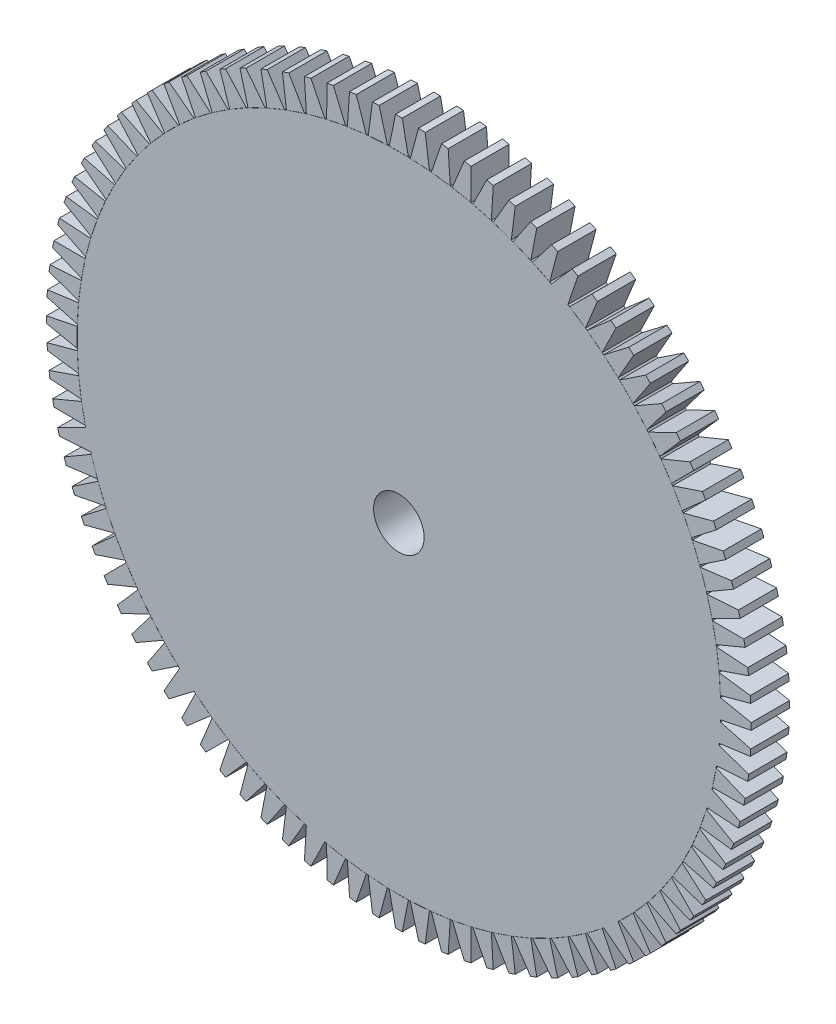
from build123d import *

# Parameters (mm, degrees)
BOSS_EXTRUDE1_DEPTH = 1.524
SKETCH2_R           = 1.00584
CUT_EXTRUDE1_DEPTH  = 1.524


with BuildPart() as part:
    # Sketch1 → Boss-Extrude1 (new body)
    with BuildSketch(Plane.XY):
        with BuildLine():
            Line((-0.133348492, 14.021434137), (-0.381, 12.795929101))
            ThreePointArc((-0.381, 12.795929101), (0, 12.8016), (0.381, 12.795929101))
            Line((0.381, 12.795929101), (0.133348492, 14.020165863))
            Line((0.133348492, 14.020165863), (-0.133348492, 14.021434137))
        make_face()
        with BuildLine():
            Line((0.381, 12.795929101), (-0.381, 12.795929101))
            ThreePointArc((-0.381, 12.795929101), (-0.418856611, 12.794745863), (-0.456709555, 12.793450627))
            Line((-0.456709555, 12.793450627), (-1.217078054, 12.743613442))
            ThreePointArc((-1.217078054, 12.743613442), (-1.254776224, 12.739956797), (-1.292463409, 12.736188633))
            Line((-1.292463409, 12.736188633), (-2.047944394, 12.636727675))
            ThreePointArc((-2.047944394, 12.636727675), (-2.085322692, 12.63061328), (-2.122682737, 12.624388324))
            Line((-2.122682737, 12.624388324), (-2.870041121, 12.475729499))
            ThreePointArc((-2.870041121, 12.475729499), (-2.906939489, 12.467183538), (-2.943812411, 12.458528446))
            Line((-2.943812411, 12.458528446), (-3.679847891, 12.261308334))
            ThreePointArc((-3.679847891, 12.261308334), (-3.716108324, 12.250367402), (-3.752336229, 12.239319237))
            Line((-3.752336229, 12.239319237), (-4.473896988, 11.994382364))
            ThreePointArc((-4.473896988, 11.994382364), (-4.509364213, 11.981093312), (-4.544791967, 11.967699384))
            Line((-4.544791967, 11.967699384), (-5.248788171, 11.676094608))
            ThreePointArc((-5.248788171, 11.676094608), (-5.283310313, 11.660514341), (-5.317786208, 11.644832004))
            Line((-5.317786208, 11.644832004), (-6.001203237, 11.307808022))
            ThreePointArc((-6.001203237, 11.307808022), (-6.034632466, 11.290003258), (-6.068008872, 11.272099667))
            Line((-6.068008872, 11.272099667), (-6.727920229, 10.891099667))
            ThreePointArc((-6.727920229, 10.891099667), (-6.760113397, 10.871146647), (-6.79224739, 10.851098468))
            Line((-6.79224739, 10.851098468), (-7.425827235, 10.42775395))
            ThreePointArc((-7.425827235, 10.42775395), (-7.456646484, 10.405738117), (-7.487400462, 10.383631199))
            Line((-7.487400462, 10.383631199), (-8.091935708, 9.91975499))
            ThreePointArc((-8.091935708, 9.91975499), (-8.121249067, 9.89577062), (-8.150491336, 9.871699627))
            Line((-8.150491336, 9.871699627), (-8.72339327, 9.369278116))
            ThreePointArc((-8.72339327, 9.369278116), (-8.751075214, 9.343427913), (-8.778680555, 9.317495923))
            Line((-8.778680555, 9.317495923), (-9.317495923, 8.778680555))
            ThreePointArc((-9.317495923, 8.778680555), (-9.343427913, 8.751075214), (-9.369278116, 8.72339327))
            Line((-9.369278116, 8.72339327), (-9.871699627, 8.150491336))
            ThreePointArc((-9.871699627, 8.150491336), (-9.89577062, 8.121249067), (-9.91975499, 8.091935708))
            Line((-9.91975499, 8.091935708), (-10.383631199, 7.487400462))
            ThreePointArc((-10.383631199, 7.487400462), (-10.405738117, 7.456646484), (-10.42775395, 7.425827235))
            Line((-10.42775395, 7.425827235), (-10.851098468, 6.79224739))
            ThreePointArc((-10.851098468, 6.79224739), (-10.871146647, 6.760113397), (-10.891099667, 6.727920229))
            Line((-10.891099667, 6.727920229), (-11.272099667, 6.068008872))
            ThreePointArc((-11.272099667, 6.068008872), (-11.290003258, 6.034632466), (-11.307808022, 6.001203237))
            Line((-11.307808022, 6.001203237), (-11.644832004, 5.317786208))
            ThreePointArc((-11.644832004, 5.317786208), (-11.660514341, 5.283310313), (-11.676094608, 5.248788171))
            Line((-11.676094608, 5.248788171), (-11.967699384, 4.544791967))
            ThreePointArc((-11.967699384, 4.544791967), (-11.981093312, 4.509364213), (-11.994382364, 4.473896988))
            Line((-11.994382364, 4.473896988), (-12.239319237, 3.752336229))
            ThreePointArc((-12.239319237, 3.752336229), (-12.250367402, 3.716108324), (-12.261308334, 3.679847891))
            Line((-12.261308334, 3.679847891), (-12.458528446, 2.943812411))
            ThreePointArc((-12.458528446, 2.943812411), (-12.467183538, 2.906939489), (-12.475729499, 2.870041121))
            Line((-12.475729499, 2.870041121), (-12.624388324, 2.122682737))
            ThreePointArc((-12.624388324, 2.122682737), (-12.63061328, 2.085322692), (-12.636727675, 2.047944394))
            Line((-12.636727675, 2.047944394), (-12.736188633, 1.292463409))
            ThreePointArc((-12.736188633, 1.292463409), (-12.739956797, 1.254776224), (-12.743613442, 1.217078054))
            Line((-12.743613442, 1.217078054), (-12.793450627, 0.456709555))
            ThreePointArc((-12.793450627, 0.456709555), (-12.794745863, 0.418856611), (-12.795929101, 0.381))
            Line((-12.795929101, 0.381), (-12.795929101, -0.381))
            ThreePointArc((-12.795929101, -0.381), (-12.794745863, -0.418856611), (-12.793450627, -0.456709555))
            Line((-12.793450627, -0.456709555), (-12.743613442, -1.217078054))
            ThreePointArc((-12.743613442, -1.217078054), (-12.739956797, -1.254776224), (-12.736188633, -1.292463409))
            Line((-12.736188633, -1.292463409), (-12.636727675, -2.047944394))
            ThreePointArc((-12.636727675, -2.047944394), (-12.63061328, -2.085322692), (-12.624388324, -2.122682737))
            Line((-12.624388324, -2.122682737), (-12.475729499, -2.870041121))
            ThreePointArc((-12.475729499, -2.870041121), (-12.467183538, -2.906939489), (-12.458528446, -2.943812411))
            Line((-12.458528446, -2.943812411), (-13.576953425, -3.499881188))
            Line((-13.576953425, -3.499881188), (-13.509152225, -3.757818947))
            Line((-13.509152225, -3.757818947), (-12.261308334, -3.679847891))
            ThreePointArc((-12.261308334, -3.679847891), (-12.250367402, -3.716108324), (-12.239319237, -3.752336229))
            Line((-12.239319237, -3.752336229), (-11.994382364, -4.473896988))
            ThreePointArc((-11.994382364, -4.473896988), (-11.981093312, -4.509364213), (-11.967699384, -4.544791967))
            Line((-11.967699384, -4.544791967), (-11.676094608, -5.248788171))
            ThreePointArc((-11.676094608, -5.248788171), (-11.660514341, -5.283310313), (-11.644832004, -5.317786208))
            Line((-11.644832004, -5.317786208), (-11.307808022, -6.001203237))
            ThreePointArc((-11.307808022, -6.001203237), (-11.290003258, -6.034632466), (-11.272099667, -6.068008872))
            Line((-11.272099667, -6.068008872), (-10.891099667, -6.727920229))
            ThreePointArc((-10.891099667, -6.727920229), (-10.871146647, -6.760113397), (-10.851098468, -6.79224739))
            Line((-10.851098468, -6.79224739), (-10.42775395, -7.425827235))
            ThreePointArc((-10.42775395, -7.425827235), (-10.405738117, -7.456646484), (-10.383631199, -7.487400462))
            Line((-10.383631199, -7.487400462), (-9.91975499, -8.091935708))
            ThreePointArc((-9.91975499, -8.091935708), (-9.89577062, -8.121249067), (-9.871699627, -8.150491336))
            Line((-9.871699627, -8.150491336), (-9.369278116, -8.72339327))
            ThreePointArc((-9.369278116, -8.72339327), (-9.343427913, -8.751075214), (-9.317495923, -8.778680555))
            Line((-9.317495923, -8.778680555), (-8.778680555, -9.317495923))
            ThreePointArc((-8.778680555, -9.317495923), (-8.751075214, -9.343427913), (-8.72339327, -9.369278116))
            Line((-8.72339327, -9.369278116), (-9.344394393, -10.452996033))
            Line((-9.344394393, -10.452996033), (-9.144717215, -10.629795113))
            Line((-9.144717215, -10.629795113), (-8.150491336, -9.871699627))
            ThreePointArc((-8.150491336, -9.871699627), (-8.121249067, -9.89577062), (-8.091935708, -9.91975499))
            Line((-8.091935708, -9.91975499), (-7.487400462, -10.383631199))
            ThreePointArc((-7.487400462, -10.383631199), (-7.456646484, -10.405738117), (-7.425827235, -10.42775395))
            Line((-7.425827235, -10.42775395), (-6.79224739, -10.851098468))
            ThreePointArc((-6.79224739, -10.851098468), (-6.760113397, -10.871146647), (-6.727920229, -10.891099667))
            Line((-6.727920229, -10.891099667), (-6.068008872, -11.272099667))
            ThreePointArc((-6.068008872, -11.272099667), (-6.034632466, -11.290003258), (-6.001203237, -11.307808022))
            Line((-6.001203237, -11.307808022), (-5.317786208, -11.644832004))
            ThreePointArc((-5.317786208, -11.644832004), (-5.283310313, -11.660514341), (-5.248788171, -11.676094608))
            Line((-5.248788171, -11.676094608), (-4.544791967, -11.967699384))
            ThreePointArc((-4.544791967, -11.967699384), (-4.509364213, -11.981093312), (-4.473896988, -11.994382364))
            Line((-4.473896988, -11.994382364), (-3.752336229, -12.239319237))
            ThreePointArc((-3.752336229, -12.239319237), (-3.716108324, -12.250367402), (-3.679847891, -12.261308334))
            Line((-3.679847891, -12.261308334), (-3.757490693, -13.507927166))
            Line((-3.757490693, -13.507927166), (-3.500209442, -13.578178484))
            Line((-3.500209442, -13.578178484), (-2.943812411, -12.458528446))
            ThreePointArc((-2.943812411, -12.458528446), (-2.906939489, -12.467183538), (-2.870041121, -12.475729499))
            Line((-2.870041121, -12.475729499), (-2.122682737, -12.624388324))
            ThreePointArc((-2.122682737, -12.624388324), (-2.085322692, -12.63061328), (-2.047944394, -12.636727675))
            Line((-2.047944394, -12.636727675), (-1.292463409, -12.736188633))
            ThreePointArc((-1.292463409, -12.736188633), (-1.254776224, -12.739956797), (-1.217078054, -12.743613442))
            Line((-1.217078054, -12.743613442), (-0.456709555, -12.793450627))
            ThreePointArc((-0.456709555, -12.793450627), (-0.418856611, -12.794745863), (-0.381, -12.795929101))
            Line((-0.381, -12.795929101), (0.381, -12.795929101))
            ThreePointArc((0.381, -12.795929101), (0.418856611, -12.794745863), (0.456709555, -12.793450627))
            Line((0.456709555, -12.793450627), (1.217078054, -12.743613442))
            ThreePointArc((1.217078054, -12.743613442), (1.254776224, -12.739956797), (1.292463409, -12.736188633))
            Line((1.292463409, -12.736188633), (2.047944394, -12.636727675))
            ThreePointArc((2.047944394, -12.636727675), (2.085322692, -12.63061328), (2.122682737, -12.624388324))
            Line((2.122682737, -12.624388324), (2.870041121, -12.475729499))
            ThreePointArc((2.870041121, -12.475729499), (2.906939489, -12.467183538), (2.943812411, -12.458528446))
            Line((2.943812411, -12.458528446), (3.679847891, -12.261308334))
            ThreePointArc((3.679847891, -12.261308334), (3.716108324, -12.250367402), (3.752336229, -12.239319237))
            Line((3.752336229, -12.239319237), (4.473896988, -11.994382364))
            ThreePointArc((4.473896988, -11.994382364), (4.509364213, -11.981093312), (4.544791967, -11.967699384))
            Line((4.544791967, -11.967699384), (5.248788171, -11.676094608))
            ThreePointArc((5.248788171, -11.676094608), (5.283310313, -11.660514341), (5.317786208, -11.644832004))
            Line((5.317786208, -11.644832004), (6.001203237, -11.307808022))
            ThreePointArc((6.001203237, -11.307808022), (6.034632466, -11.290003258), (6.068008872, -11.272099667))
            Line((6.068008872, -11.272099667), (6.727920229, -10.891099667))
            ThreePointArc((6.727920229, -10.891099667), (6.760113397, -10.871146647), (6.79224739, -10.851098468))
            Line((6.79224739, -10.851098468), (7.425827235, -10.42775395))
            ThreePointArc((7.425827235, -10.42775395), (7.456646484, -10.405738117), (7.487400462, -10.383631199))
            Line((7.487400462, -10.383631199), (8.091935708, -9.91975499))
            ThreePointArc((8.091935708, -9.91975499), (8.121249067, -9.89577062), (8.150491336, -9.871699627))
            Line((8.150491336, -9.871699627), (9.143880984, -10.628841573))
            Line((9.143880984, -10.628841573), (9.345230625, -10.453949572))
            Line((9.345230625, -10.453949572), (8.72339327, -9.369278116))
            ThreePointArc((8.72339327, -9.369278116), (8.751075214, -9.343427913), (8.778680555, -9.317495923))
            Line((8.778680555, -9.317495923), (9.317495923, -8.778680555))
            ThreePointArc((9.317495923, -8.778680555), (9.343427913, -8.751075214), (9.369278116, -8.72339327))
            Line((9.369278116, -8.72339327), (9.871699627, -8.150491336))
            ThreePointArc((9.871699627, -8.150491336), (9.89577062, -8.121249067), (9.91975499, -8.091935708))
            Line((9.91975499, -8.091935708), (10.383631199, -7.487400462))
            ThreePointArc((10.383631199, -7.487400462), (10.405738117, -7.456646484), (10.42775395, -7.425827235))
            Line((10.42775395, -7.425827235), (10.851098468, -6.79224739))
            ThreePointArc((10.851098468, -6.79224739), (10.871146647, -6.760113397), (10.891099667, -6.727920229))
            Line((10.891099667, -6.727920229), (11.272099667, -6.068008872))
            ThreePointArc((11.272099667, -6.068008872), (11.290003258, -6.034632466), (11.307808022, -6.001203237))
            Line((11.307808022, -6.001203237), (11.644832004, -5.317786208))
            ThreePointArc((11.644832004, -5.317786208), (11.660514341, -5.283310313), (11.676094608, -5.248788171))
            Line((11.676094608, -5.248788171), (11.967699384, -4.544791967))
            ThreePointArc((11.967699384, -4.544791967), (11.981093312, -4.509364213), (11.994382364, -4.473896988))
            Line((11.994382364, -4.473896988), (12.239319237, -3.752336229))
            ThreePointArc((12.239319237, -3.752336229), (12.250367402, -3.716108324), (12.261308334, -3.679847891))
            Line((12.261308334, -3.679847891), (13.507927166, -3.757490693))
            Line((13.507927166, -3.757490693), (13.578178484, -3.500209442))
            Line((13.578178484, -3.500209442), (12.458528446, -2.943812411))
            ThreePointArc((12.458528446, -2.943812411), (12.467183538, -2.906939489), (12.475729499, -2.870041121))
            Line((12.475729499, -2.870041121), (12.624388324, -2.122682737))
            ThreePointArc((12.624388324, -2.122682737), (12.63061328, -2.085322692), (12.636727675, -2.047944394))
            Line((12.636727675, -2.047944394), (13.882815929, -1.962206542))
            Line((13.882815929, -1.962206542), (13.918884295, -1.69795673))
            Line((13.918884295, -1.69795673), (12.736188633, -1.292463409))
            ThreePointArc((12.736188633, -1.292463409), (12.739956797, -1.254776224), (12.743613442, -1.217078054))
            Line((12.743613442, -1.217078054), (13.981426203, -1.050025703))
            Line((13.981426203, -1.050025703), (14.000134579, -0.783982686))
            Line((14.000134579, -0.783982686), (12.793450627, -0.456709555))
            ThreePointArc((12.793450627, -0.456709555), (12.794745863, -0.418856611), (12.795929101, -0.381))
            Line((12.795929101, -0.381), (14.020165863, -0.133348492))
            Line((14.020165863, -0.133348492), (14.021434137, 0.133348492))
            Line((14.021434137, 0.133348492), (12.795929101, 0.381))
            ThreePointArc((12.795929101, 0.381), (12.794745863, 0.418856611), (12.793450627, 0.456709555))
            Line((12.793450627, 0.456709555), (12.743613442, 1.217078054))
            ThreePointArc((12.743613442, 1.217078054), (12.739956797, 1.254776224), (12.736188633, 1.292463409))
            Line((12.736188633, 1.292463409), (12.636727675, 2.047944394))
            ThreePointArc((12.636727675, 2.047944394), (12.63061328, 2.085322692), (12.624388324, 2.122682737))
            Line((12.624388324, 2.122682737), (12.475729499, 2.870041121))
            ThreePointArc((12.475729499, 2.870041121), (12.467183538, 2.906939489), (12.458528446, 2.943812411))
            Line((12.458528446, 2.943812411), (12.261308334, 3.679847891))
            ThreePointArc((12.261308334, 3.679847891), (12.250367402, 3.716108324), (12.239319237, 3.752336229))
            Line((12.239319237, 3.752336229), (11.994382364, 4.473896988))
            ThreePointArc((11.994382364, 4.473896988), (11.981093312, 4.509364213), (11.967699384, 4.544791967))
            Line((11.967699384, 4.544791967), (11.676094608, 5.248788171))
            ThreePointArc((11.676094608, 5.248788171), (11.660514341, 5.283310313), (11.644832004, 5.317786208))
            Line((11.644832004, 5.317786208), (11.307808022, 6.001203237))
            ThreePointArc((11.307808022, 6.001203237), (11.290003258, 6.034632466), (11.272099667, 6.068008872))
            Line((11.272099667, 6.068008872), (10.891099667, 6.727920229))
            ThreePointArc((10.891099667, 6.727920229), (10.871146647, 6.760113397), (10.851098468, 6.79224739))
            Line((10.851098468, 6.79224739), (10.42775395, 7.425827235))
            ThreePointArc((10.42775395, 7.425827235), (10.405738117, 7.456646484), (10.383631199, 7.487400462))
            Line((10.383631199, 7.487400462), (9.91975499, 8.091935708))
            ThreePointArc((9.91975499, 8.091935708), (9.89577062, 8.121249067), (9.871699627, 8.150491336))
            Line((9.871699627, 8.150491336), (9.369278116, 8.72339327))
            ThreePointArc((9.369278116, 8.72339327), (9.343427913, 8.751075214), (9.317495923, 8.778680555))
            Line((9.317495923, 8.778680555), (8.778680555, 9.317495923))
            ThreePointArc((8.778680555, 9.317495923), (8.751075214, 9.343427913), (8.72339327, 9.369278116))
            Line((8.72339327, 9.369278116), (8.150491336, 9.871699627))
            ThreePointArc((8.150491336, 9.871699627), (8.121249067, 9.89577062), (8.091935708, 9.91975499))
            Line((8.091935708, 9.91975499), (7.487400462, 10.383631199))
            ThreePointArc((7.487400462, 10.383631199), (7.456646484, 10.405738117), (7.425827235, 10.42775395))
            Line((7.425827235, 10.42775395), (6.79224739, 10.851098468))
            ThreePointArc((6.79224739, 10.851098468), (6.760113397, 10.871146647), (6.727920229, 10.891099667))
            Line((6.727920229, 10.891099667), (7.125566113, 12.075145556))
            Line((7.125566113, 12.075145556), (6.895233887, 12.209592406))
            Line((6.895233887, 12.209592406), (6.068008872, 11.272099667))
            ThreePointArc((6.068008872, 11.272099667), (6.034632466, 11.290003258), (6.001203237, 11.307808022))
            Line((6.001203237, 11.307808022), (5.317786208, 11.644832004))
            ThreePointArc((5.317786208, 11.644832004), (5.283310313, 11.660514341), (5.248788171, 11.676094608))
            Line((5.248788171, 11.676094608), (4.544791967, 11.967699384))
            ThreePointArc((4.544791967, 11.967699384), (4.509364213, 11.981093312), (4.473896988, 11.994382364))
            Line((4.473896988, 11.994382364), (3.752336229, 12.239319237))
            ThreePointArc((3.752336229, 12.239319237), (3.716108324, 12.250367402), (3.679847891, 12.261308334))
            Line((3.679847891, 12.261308334), (2.943812411, 12.458528446))
            ThreePointArc((2.943812411, 12.458528446), (2.906939489, 12.467183538), (2.870041121, 12.475729499))
            Line((2.870041121, 12.475729499), (2.122682737, 12.624388324))
            ThreePointArc((2.122682737, 12.624388324), (2.085322692, 12.63061328), (2.047944394, 12.636727675))
            Line((2.047944394, 12.636727675), (1.292463409, 12.736188633))
            ThreePointArc((1.292463409, 12.736188633), (1.254776224, 12.739956797), (1.217078054, 12.743613442))
            Line((1.217078054, 12.743613442), (0.456709555, 12.793450627))
            ThreePointArc((0.456709555, 12.793450627), (0.418856611, 12.794745863), (0.381, 12.795929101))
        make_face()
        with BuildLine():
            ThreePointArc((-1.217078054, 12.743613442), (-0.837264699, 12.774190792), (-0.456709555, 12.793450627))
            Line((-0.456709555, 12.793450627), (-0.783899737, 13.99886902))
            Line((-0.783899737, 13.99886902), (-1.050108652, 13.982691762))
            Line((-1.050108652, 13.982691762), (-1.217078054, 12.743613442))
        make_face()
        with BuildLine():
            Line((0.783982686, 14.000134579), (0.456709555, 12.793450627))
            ThreePointArc((0.456709555, 12.793450627), (0.837264699, 12.774190792), (1.217078054, 12.743613442))
            Line((1.217078054, 12.743613442), (1.050025703, 13.981426203))
            Line((1.050025703, 13.981426203), (0.783982686, 14.000134579))
        make_face()
        with BuildLine():
            ThreePointArc((-2.047944394, 12.636727675), (-1.670944102, 12.692080537), (-1.292463409, 12.736188633))
            Line((-1.292463409, 12.736188633), (-1.697791187, 13.917626871))
            Line((-1.697791187, 13.917626871), (-1.962372085, 13.884073354))
            Line((-1.962372085, 13.884073354), (-2.047944394, 12.636727675))
        make_face()
        with BuildLine():
            Line((1.69795673, 13.918884295), (1.292463409, 12.736188633))
            ThreePointArc((1.292463409, 12.736188633), (1.670944102, 12.692080537), (2.047944394, 12.636727675))
            Line((2.047944394, 12.636727675), (1.962206542, 13.882815929))
            Line((1.962206542, 13.882815929), (1.69795673, 13.918884295))
        make_face()
        with BuildLine():
            ThreePointArc((-2.870041121, 12.475729499), (-2.497468266, 12.555620846), (-2.122682737, 12.624388324))
            Line((-2.122682737, 12.624388324), (-2.604412435, 13.776787307))
            Line((-2.604412435, 13.776787307), (-2.866232339, 13.726001212))
            Line((-2.866232339, 13.726001212), (-2.870041121, 12.475729499))
        make_face()
        with BuildLine():
            Line((2.604659863, 13.778031212), (2.122682737, 12.624388324))
            ThreePointArc((2.122682737, 12.624388324), (2.497468266, 12.555620846), (2.870041121, 12.475729499))
            Line((2.870041121, 12.475729499), (2.865984911, 13.724757307))
            Line((2.865984911, 13.724757307), (2.604659863, 13.778031212))
        make_face()
        with BuildLine():
            ThreePointArc((-3.679847891, 12.261308334), (-3.313297888, 12.365396058), (-2.943812411, 12.458528446))
            Line((-2.943812411, 12.458528446), (-3.499881188, 13.576953425))
            Line((-3.499881188, 13.576953425), (-3.757818947, 13.509152225))
            Line((-3.757818947, 13.509152225), (-3.679847891, 12.261308334))
        make_face()
        with BuildLine():
            Line((3.500209442, 13.578178484), (2.943812411, 12.458528446))
            ThreePointArc((2.943812411, 12.458528446), (3.313297888, 12.365396058), (3.679847891, 12.261308334))
            Line((3.679847891, 12.261308334), (3.757490693, 13.507927166))
            Line((3.757490693, 13.507927166), (3.500209442, 13.578178484))
        make_face()
        with BuildLine():
            ThreePointArc((-4.473896988, 11.994382364), (-4.114939459, 12.122220746), (-3.752336229, 12.239319237))
            Line((-3.752336229, 12.239319237), (-4.380362913, 13.318980944))
            Line((-4.380362913, 13.318980944), (-4.633313997, 13.234454975))
            Line((-4.633313997, 13.234454975), (-4.473896988, 11.994382364))
        make_face()
        with BuildLine():
            Line((4.380770587, 13.320181911), (3.752336229, 12.239319237))
            ThreePointArc((3.752336229, 12.239319237), (4.114939459, 12.122220746), (4.473896988, 11.994382364))
            Line((4.473896988, 11.994382364), (4.632906323, 13.233254008))
            Line((4.632906323, 13.233254008), (4.380770587, 13.320181911))
        make_face()
        with BuildLine():
            ThreePointArc((-5.248788171, 11.676094608), (-4.898960228, 11.827136223), (-4.544791967, 11.967699384))
            Line((-4.544791967, 11.967699384), (-5.242087252, 13.003974542))
            Line((-5.242087252, 13.003974542), (-5.488968485, 12.903085757))
            Line((-5.488968485, 12.903085757), (-5.248788171, 11.676094608))
        make_face()
        with BuildLine():
            Line((5.2425726, 13.005146275), (4.544791967, 11.967699384))
            ThreePointArc((4.544791967, 11.967699384), (4.898960228, 11.827136223), (5.248788171, 11.676094608))
            Line((5.248788171, 11.676094608), (5.488483137, 12.901914024))
            Line((5.488483137, 12.901914024), (5.2425726, 13.005146275))
        make_face()
        with BuildLine():
            ThreePointArc((-6.001203237, 11.307808022), (-5.662002897, 11.481406088), (-5.317786208, 11.644832004))
            Line((-5.317786208, 11.644832004), (-6.081364168, 12.633283124))
            Line((-6.081364168, 12.633283124), (-6.321118367, 12.516463545))
            Line((-6.321118367, 12.516463545), (-6.001203237, 11.307808022))
        make_face()
        with BuildLine():
            Line((6.081925112, 12.634420605), (5.317786208, 11.644832004))
            ThreePointArc((5.317786208, 11.644832004), (5.662002897, 11.481406088), (6.001203237, 11.307808022))
            Line((6.001203237, 11.307808022), (6.320557424, 12.515326064))
            Line((6.320557424, 12.515326064), (6.081925112, 12.634420605))
        make_face()
        with BuildLine():
            ThreePointArc((-6.727920229, 10.891099667), (-6.4008, 11.086510809), (-6.068008872, 11.272099667))
            Line((-6.068008872, 11.272099667), (-6.89459975, 12.208494049))
            Line((-6.89459975, 12.208494049), (-7.12620025, 12.076243914))
            Line((-7.12620025, 12.076243914), (-6.727920229, 10.891099667))
        make_face()
        with BuildLine():
            ThreePointArc((-7.425827235, 10.42775395), (-7.112187895, 10.644141389), (-6.79224739, 10.851098468))
            Line((-6.79224739, 10.851098468), (-7.678311596, 11.731426327))
            Line((-7.678311596, 11.731426327), (-7.90076665, 11.584311953))
            Line((-7.90076665, 11.584311953), (-7.425827235, 10.42775395))
        make_face()
        with BuildLine():
            Line((7.679016212, 11.732480859), (6.79224739, 10.851098468))
            ThreePointArc((6.79224739, 10.851098468), (7.112187895, 10.644141389), (7.425827235, 10.42775395))
            Line((7.425827235, 10.42775395), (7.900062034, 11.583257421))
            Line((7.900062034, 11.583257421), (7.679016212, 11.732480859))
        make_face()
        with BuildLine():
            ThreePointArc((-8.091935708, 9.91975499), (-7.79312031, 10.156192121), (-7.487400462, 10.383631199))
            Line((-7.487400462, 10.383631199), (-8.429143734, 11.204122837))
            Line((-8.429143734, 11.204122837), (-8.641500754, 11.04277419))
            Line((-8.641500754, 11.04277419), (-8.091935708, 9.91975499))
        make_face()
        with BuildLine():
            Line((8.42991581, 11.205129027), (7.487400462, 10.383631199))
            ThreePointArc((7.487400462, 10.383631199), (7.79312031, 10.156192121), (8.091935708, 9.91975499))
            Line((8.091935708, 9.91975499), (8.640728677, 11.041768))
            Line((8.640728677, 11.041768), (8.42991581, 11.205129027))
        make_face()
        with BuildLine():
            ThreePointArc((-8.72339327, 9.369278116), (-8.440681387, 9.624752479), (-8.150491336, 9.871699627))
            Line((-8.150491336, 9.871699627), (-9.143880984, 10.628841573))
            Line((-9.143880984, 10.628841573), (-9.345230625, 10.453949572))
            Line((-9.345230625, 10.453949572), (-8.72339327, 9.369278116))
        make_face()
        with BuildLine():
            Line((9.144717215, 10.629795113), (8.150491336, 9.871699627))
            ThreePointArc((8.150491336, 9.871699627), (8.440681387, 9.624752479), (8.72339327, 9.369278116))
            Line((8.72339327, 9.369278116), (9.344394393, 10.452996033))
            Line((9.344394393, 10.452996033), (9.144717215, 10.629795113))
        make_face()
        with BuildLine():
            ThreePointArc((-9.317495923, 8.778680555), (-9.05209817, 9.05209817), (-8.778680555, 9.317495923))
            Line((-8.778680555, 9.317495923), (-9.819462732, 10.008045978))
            Line((-9.819462732, 10.008045978), (-10.008942783, 9.820359537))
            Line((-10.008942783, 9.820359537), (-9.317495923, 8.778680555))
        make_face()
        with BuildLine():
            Line((9.820359537, 10.008942783), (8.778680555, 9.317495923))
            ThreePointArc((8.778680555, 9.317495923), (9.05209817, 9.05209817), (9.317495923, 8.778680555))
            Line((9.317495923, 8.778680555), (10.008045978, 9.819462732))
            Line((10.008045978, 9.819462732), (9.820359537, 10.008942783))
        make_face()
        with BuildLine():
            ThreePointArc((-9.871699627, 8.150491336), (-9.624752479, 8.440681387), (-9.369278116, 8.72339327))
            Line((-9.369278116, 8.72339327), (-10.452996033, 9.344394393))
            Line((-10.452996033, 9.344394393), (-10.629795113, 9.144717215))
            Line((-10.629795113, 9.144717215), (-9.871699627, 8.150491336))
        make_face()
        with BuildLine():
            Line((10.453949572, 9.345230625), (9.369278116, 8.72339327))
            ThreePointArc((9.369278116, 8.72339327), (9.624752479, 8.440681387), (9.871699627, 8.150491336))
            Line((9.871699627, 8.150491336), (10.628841573, 9.143880984))
            Line((10.628841573, 9.143880984), (10.453949572, 9.345230625))
        make_face()
        with BuildLine():
            ThreePointArc((-10.383631199, 7.487400462), (-10.156192121, 7.79312031), (-9.91975499, 8.091935708))
            Line((-9.91975499, 8.091935708), (-11.041768, 8.640728677))
            Line((-11.041768, 8.640728677), (-11.205129027, 8.42991581))
            Line((-11.205129027, 8.42991581), (-10.383631199, 7.487400462))
        make_face()
        with BuildLine():
            Line((11.04277419, 8.641500754), (9.91975499, 8.091935708))
            ThreePointArc((9.91975499, 8.091935708), (10.156192121, 7.79312031), (10.383631199, 7.487400462))
            Line((10.383631199, 7.487400462), (11.204122837, 8.429143734))
            Line((11.204122837, 8.429143734), (11.04277419, 8.641500754))
        make_face()
        with BuildLine():
            ThreePointArc((-10.851098468, 6.79224739), (-10.644141389, 7.112187895), (-10.42775395, 7.425827235))
            Line((-10.42775395, 7.425827235), (-11.583257421, 7.900062034))
            Line((-11.583257421, 7.900062034), (-11.732480859, 7.679016212))
            Line((-11.732480859, 7.679016212), (-10.851098468, 6.79224739))
        make_face()
        with BuildLine():
            Line((11.584311953, 7.90076665), (10.42775395, 7.425827235))
            ThreePointArc((10.42775395, 7.425827235), (10.644141389, 7.112187895), (10.851098468, 6.79224739))
            Line((10.851098468, 6.79224739), (11.731426327, 7.678311596))
            Line((11.731426327, 7.678311596), (11.584311953, 7.90076665))
        make_face()
        with BuildLine():
            ThreePointArc((-11.272099667, 6.068008872), (-11.086510809, 6.4008), (-10.891099667, 6.727920229))
            Line((-10.891099667, 6.727920229), (-12.075145556, 7.125566113))
            Line((-12.075145556, 7.125566113), (-12.209592406, 6.895233887))
            Line((-12.209592406, 6.895233887), (-11.272099667, 6.068008872))
        make_face()
        with BuildLine():
            Line((12.076243914, 7.12620025), (10.891099667, 6.727920229))
            ThreePointArc((10.891099667, 6.727920229), (11.086510809, 6.4008), (11.272099667, 6.068008872))
            Line((11.272099667, 6.068008872), (12.208494049, 6.89459975))
            Line((12.208494049, 6.89459975), (12.076243914, 7.12620025))
        make_face()
        with BuildLine():
            ThreePointArc((-11.644832004, 5.317786208), (-11.481406088, 5.662002897), (-11.307808022, 6.001203237))
            Line((-11.307808022, 6.001203237), (-12.515326064, 6.320557424))
            Line((-12.515326064, 6.320557424), (-12.634420605, 6.081925112))
            Line((-12.634420605, 6.081925112), (-11.644832004, 5.317786208))
        make_face()
        with BuildLine():
            Line((12.516463545, 6.321118367), (11.307808022, 6.001203237))
            ThreePointArc((11.307808022, 6.001203237), (11.481406088, 5.662002897), (11.644832004, 5.317786208))
            Line((11.644832004, 5.317786208), (12.633283124, 6.081364168))
            Line((12.633283124, 6.081364168), (12.516463545, 6.321118367))
        make_face()
        with BuildLine():
            ThreePointArc((-11.967699384, 4.544791967), (-11.827136223, 4.898960228), (-11.676094608, 5.248788171))
            Line((-11.676094608, 5.248788171), (-12.901914024, 5.488483137))
            Line((-12.901914024, 5.488483137), (-13.005146275, 5.2425726))
            Line((-13.005146275, 5.2425726), (-11.967699384, 4.544791967))
        make_face()
        with BuildLine():
            Line((12.903085757, 5.488968485), (11.676094608, 5.248788171))
            ThreePointArc((11.676094608, 5.248788171), (11.827136223, 4.898960228), (11.967699384, 4.544791967))
            Line((11.967699384, 4.544791967), (13.003974542, 5.242087252))
            Line((13.003974542, 5.242087252), (12.903085757, 5.488968485))
        make_face()
        with BuildLine():
            ThreePointArc((-12.239319237, 3.752336229), (-12.122220746, 4.114939459), (-11.994382364, 4.473896988))
            Line((-11.994382364, 4.473896988), (-13.233254008, 4.632906323))
            Line((-13.233254008, 4.632906323), (-13.320181911, 4.380770587))
            Line((-13.320181911, 4.380770587), (-12.239319237, 3.752336229))
        make_face()
        with BuildLine():
            Line((13.234454975, 4.633313997), (11.994382364, 4.473896988))
            ThreePointArc((11.994382364, 4.473896988), (12.122220746, 4.114939459), (12.239319237, 3.752336229))
            Line((12.239319237, 3.752336229), (13.318980944, 4.380362913))
            Line((13.318980944, 4.380362913), (13.234454975, 4.633313997))
        make_face()
        with BuildLine():
            ThreePointArc((-12.458528446, 2.943812411), (-12.365396058, 3.313297888), (-12.261308334, 3.679847891))
            Line((-12.261308334, 3.679847891), (-13.507927166, 3.757490693))
            Line((-13.507927166, 3.757490693), (-13.578178484, 3.500209442))
            Line((-13.578178484, 3.500209442), (-12.458528446, 2.943812411))
        make_face()
        with BuildLine():
            Line((13.509152225, 3.757818947), (12.261308334, 3.679847891))
            ThreePointArc((12.261308334, 3.679847891), (12.365396058, 3.313297888), (12.458528446, 2.943812411))
            Line((12.458528446, 2.943812411), (13.576953425, 3.499881188))
            Line((13.576953425, 3.499881188), (13.509152225, 3.757818947))
        make_face()
        with BuildLine():
            ThreePointArc((-12.624388324, 2.122682737), (-12.555620846, 2.497468266), (-12.475729499, 2.870041121))
            Line((-12.475729499, 2.870041121), (-13.724757307, 2.865984911))
            Line((-13.724757307, 2.865984911), (-13.778031212, 2.604659863))
            Line((-13.778031212, 2.604659863), (-12.624388324, 2.122682737))
        make_face()
        with BuildLine():
            Line((13.726001212, 2.866232339), (12.475729499, 2.870041121))
            ThreePointArc((12.475729499, 2.870041121), (12.555620846, 2.497468266), (12.624388324, 2.122682737))
            Line((12.624388324, 2.122682737), (13.776787307, 2.604412435))
            Line((13.776787307, 2.604412435), (13.726001212, 2.866232339))
        make_face()
        with BuildLine():
            ThreePointArc((-12.736188633, 1.292463409), (-12.692080537, 1.670944102), (-12.636727675, 2.047944394))
            Line((-12.636727675, 2.047944394), (-13.882815929, 1.962206542))
            Line((-13.882815929, 1.962206542), (-13.918884295, 1.69795673))
            Line((-13.918884295, 1.69795673), (-12.736188633, 1.292463409))
        make_face()
        with BuildLine():
            Line((13.884073354, 1.962372085), (12.636727675, 2.047944394))
            ThreePointArc((12.636727675, 2.047944394), (12.692080537, 1.670944102), (12.736188633, 1.292463409))
            Line((12.736188633, 1.292463409), (13.917626871, 1.697791187))
            Line((13.917626871, 1.697791187), (13.884073354, 1.962372085))
        make_face()
        with BuildLine():
            ThreePointArc((-12.793450627, 0.456709555), (-12.774190792, 0.837264699), (-12.743613442, 1.217078054))
            Line((-12.743613442, 1.217078054), (-13.981426203, 1.050025703))
            Line((-13.981426203, 1.050025703), (-14.000134579, 0.783982686))
            Line((-14.000134579, 0.783982686), (-12.793450627, 0.456709555))
        make_face()
        with BuildLine():
            Line((13.982691762, 1.050108652), (12.743613442, 1.217078054))
            ThreePointArc((12.743613442, 1.217078054), (12.774190792, 0.837264699), (12.793450627, 0.456709555))
            Line((12.793450627, 0.456709555), (13.99886902, 0.783899737))
            Line((13.99886902, 0.783899737), (13.982691762, 1.050108652))
        make_face()
        with BuildLine():
            ThreePointArc((-12.795929101, -0.381), (-12.8016, 0), (-12.795929101, 0.381))
            Line((-12.795929101, 0.381), (-14.020165863, 0.133348492))
            Line((-14.020165863, 0.133348492), (-14.021434137, -0.133348492))
            Line((-14.021434137, -0.133348492), (-12.795929101, -0.381))
        make_face()
        with BuildLine():
            ThreePointArc((-12.743613442, -1.217078054), (-12.774190792, -0.837264699), (-12.793450627, -0.456709555))
            Line((-12.793450627, -0.456709555), (-13.99886902, -0.783899737))
            Line((-13.99886902, -0.783899737), (-13.982691762, -1.050108652))
            Line((-13.982691762, -1.050108652), (-12.743613442, -1.217078054))
        make_face()
        with BuildLine():
            ThreePointArc((-12.636727675, -2.047944394), (-12.692080537, -1.670944102), (-12.736188633, -1.292463409))
            Line((-12.736188633, -1.292463409), (-13.917626871, -1.697791187))
            Line((-13.917626871, -1.697791187), (-13.884073354, -1.962372085))
            Line((-13.884073354, -1.962372085), (-12.636727675, -2.047944394))
        make_face()
        with BuildLine():
            ThreePointArc((-12.475729499, -2.870041121), (-12.555620846, -2.497468266), (-12.624388324, -2.122682737))
            Line((-12.624388324, -2.122682737), (-13.776787307, -2.604412435))
            Line((-13.776787307, -2.604412435), (-13.726001212, -2.866232339))
            Line((-13.726001212, -2.866232339), (-12.475729499, -2.870041121))
        make_face()
        with BuildLine():
            Line((13.778031212, -2.604659863), (12.624388324, -2.122682737))
            ThreePointArc((12.624388324, -2.122682737), (12.555620846, -2.497468266), (12.475729499, -2.870041121))
            Line((12.475729499, -2.870041121), (13.724757307, -2.865984911))
            Line((13.724757307, -2.865984911), (13.778031212, -2.604659863))
        make_face()
        with BuildLine():
            ThreePointArc((-11.994382364, -4.473896988), (-12.122220746, -4.114939459), (-12.239319237, -3.752336229))
            Line((-12.239319237, -3.752336229), (-13.318980944, -4.380362913))
            Line((-13.318980944, -4.380362913), (-13.234454975, -4.633313997))
            Line((-13.234454975, -4.633313997), (-11.994382364, -4.473896988))
        make_face()
        with BuildLine():
            Line((13.320181911, -4.380770587), (12.239319237, -3.752336229))
            ThreePointArc((12.239319237, -3.752336229), (12.122220746, -4.114939459), (11.994382364, -4.473896988))
            Line((11.994382364, -4.473896988), (13.233254008, -4.632906323))
            Line((13.233254008, -4.632906323), (13.320181911, -4.380770587))
        make_face()
        with BuildLine():
            ThreePointArc((-11.676094608, -5.248788171), (-11.827136223, -4.898960228), (-11.967699384, -4.544791967))
            Line((-11.967699384, -4.544791967), (-13.003974542, -5.242087252))
            Line((-13.003974542, -5.242087252), (-12.903085757, -5.488968485))
            Line((-12.903085757, -5.488968485), (-11.676094608, -5.248788171))
        make_face()
        with BuildLine():
            Line((13.005146275, -5.2425726), (11.967699384, -4.544791967))
            ThreePointArc((11.967699384, -4.544791967), (11.827136223, -4.898960228), (11.676094608, -5.248788171))
            Line((11.676094608, -5.248788171), (12.901914024, -5.488483137))
            Line((12.901914024, -5.488483137), (13.005146275, -5.2425726))
        make_face()
        with BuildLine():
            ThreePointArc((-11.307808022, -6.001203237), (-11.481406088, -5.662002897), (-11.644832004, -5.317786208))
            Line((-11.644832004, -5.317786208), (-12.633283124, -6.081364168))
            Line((-12.633283124, -6.081364168), (-12.516463545, -6.321118367))
            Line((-12.516463545, -6.321118367), (-11.307808022, -6.001203237))
        make_face()
        with BuildLine():
            Line((12.634420605, -6.081925112), (11.644832004, -5.317786208))
            ThreePointArc((11.644832004, -5.317786208), (11.481406088, -5.662002897), (11.307808022, -6.001203237))
            Line((11.307808022, -6.001203237), (12.515326064, -6.320557424))
            Line((12.515326064, -6.320557424), (12.634420605, -6.081925112))
        make_face()
        with BuildLine():
            ThreePointArc((-10.891099667, -6.727920229), (-11.086510809, -6.4008), (-11.272099667, -6.068008872))
            Line((-11.272099667, -6.068008872), (-12.208494049, -6.89459975))
            Line((-12.208494049, -6.89459975), (-12.076243914, -7.12620025))
            Line((-12.076243914, -7.12620025), (-10.891099667, -6.727920229))
        make_face()
        with BuildLine():
            Line((12.209592406, -6.895233887), (11.272099667, -6.068008872))
            ThreePointArc((11.272099667, -6.068008872), (11.086510809, -6.4008), (10.891099667, -6.727920229))
            Line((10.891099667, -6.727920229), (12.075145556, -7.125566113))
            Line((12.075145556, -7.125566113), (12.209592406, -6.895233887))
        make_face()
        with BuildLine():
            ThreePointArc((-10.42775395, -7.425827235), (-10.644141389, -7.112187895), (-10.851098468, -6.79224739))
            Line((-10.851098468, -6.79224739), (-11.731426327, -7.678311596))
            Line((-11.731426327, -7.678311596), (-11.584311953, -7.90076665))
            Line((-11.584311953, -7.90076665), (-10.42775395, -7.425827235))
        make_face()
        with BuildLine():
            Line((11.732480859, -7.679016212), (10.851098468, -6.79224739))
            ThreePointArc((10.851098468, -6.79224739), (10.644141389, -7.112187895), (10.42775395, -7.425827235))
            Line((10.42775395, -7.425827235), (11.583257421, -7.900062034))
            Line((11.583257421, -7.900062034), (11.732480859, -7.679016212))
        make_face()
        with BuildLine():
            ThreePointArc((-9.91975499, -8.091935708), (-10.156192121, -7.79312031), (-10.383631199, -7.487400462))
            Line((-10.383631199, -7.487400462), (-11.204122837, -8.429143734))
            Line((-11.204122837, -8.429143734), (-11.04277419, -8.641500754))
            Line((-11.04277419, -8.641500754), (-9.91975499, -8.091935708))
        make_face()
        with BuildLine():
            Line((11.205129027, -8.42991581), (10.383631199, -7.487400462))
            ThreePointArc((10.383631199, -7.487400462), (10.156192121, -7.79312031), (9.91975499, -8.091935708))
            Line((9.91975499, -8.091935708), (11.041768, -8.640728677))
            Line((11.041768, -8.640728677), (11.205129027, -8.42991581))
        make_face()
        with BuildLine():
            ThreePointArc((-9.369278116, -8.72339327), (-9.624752479, -8.440681387), (-9.871699627, -8.150491336))
            Line((-9.871699627, -8.150491336), (-10.628841573, -9.143880984))
            Line((-10.628841573, -9.143880984), (-10.453949572, -9.345230625))
            Line((-10.453949572, -9.345230625), (-9.369278116, -8.72339327))
        make_face()
        with BuildLine():
            Line((10.629795113, -9.144717215), (9.871699627, -8.150491336))
            ThreePointArc((9.871699627, -8.150491336), (9.624752479, -8.440681387), (9.369278116, -8.72339327))
            Line((9.369278116, -8.72339327), (10.452996033, -9.344394393))
            Line((10.452996033, -9.344394393), (10.629795113, -9.144717215))
        make_face()
        with BuildLine():
            ThreePointArc((-8.778680555, -9.317495923), (-9.05209817, -9.05209817), (-9.317495923, -8.778680555))
            Line((-9.317495923, -8.778680555), (-10.008045978, -9.819462732))
            Line((-10.008045978, -9.819462732), (-9.820359537, -10.008942783))
            Line((-9.820359537, -10.008942783), (-8.778680555, -9.317495923))
        make_face()
        with BuildLine():
            Line((10.008942783, -9.820359537), (9.317495923, -8.778680555))
            ThreePointArc((9.317495923, -8.778680555), (9.05209817, -9.05209817), (8.778680555, -9.317495923))
            Line((8.778680555, -9.317495923), (9.819462732, -10.008045978))
            Line((9.819462732, -10.008045978), (10.008942783, -9.820359537))
        make_face()
        with BuildLine():
            ThreePointArc((-7.487400462, -10.383631199), (-7.79312031, -10.156192121), (-8.091935708, -9.91975499))
            Line((-8.091935708, -9.91975499), (-8.640728677, -11.041768))
            Line((-8.640728677, -11.041768), (-8.42991581, -11.205129027))
            Line((-8.42991581, -11.205129027), (-7.487400462, -10.383631199))
        make_face()
        with BuildLine():
            Line((8.641500754, -11.04277419), (8.091935708, -9.91975499))
            ThreePointArc((8.091935708, -9.91975499), (7.79312031, -10.156192121), (7.487400462, -10.383631199))
            Line((7.487400462, -10.383631199), (8.429143734, -11.204122837))
            Line((8.429143734, -11.204122837), (8.641500754, -11.04277419))
        make_face()
        with BuildLine():
            ThreePointArc((-6.79224739, -10.851098468), (-7.112187895, -10.644141389), (-7.425827235, -10.42775395))
            Line((-7.425827235, -10.42775395), (-7.900062034, -11.583257421))
            Line((-7.900062034, -11.583257421), (-7.679016212, -11.732480859))
            Line((-7.679016212, -11.732480859), (-6.79224739, -10.851098468))
        make_face()
        with BuildLine():
            Line((7.90076665, -11.584311953), (7.425827235, -10.42775395))
            ThreePointArc((7.425827235, -10.42775395), (7.112187895, -10.644141389), (6.79224739, -10.851098468))
            Line((6.79224739, -10.851098468), (7.678311596, -11.731426327))
            Line((7.678311596, -11.731426327), (7.90076665, -11.584311953))
        make_face()
        with BuildLine():
            ThreePointArc((-6.068008872, -11.272099667), (-6.4008, -11.086510809), (-6.727920229, -10.891099667))
            Line((-6.727920229, -10.891099667), (-7.125566113, -12.075145556))
            Line((-7.125566113, -12.075145556), (-6.895233887, -12.209592406))
            Line((-6.895233887, -12.209592406), (-6.068008872, -11.272099667))
        make_face()
        with BuildLine():
            Line((7.12620025, -12.076243914), (6.727920229, -10.891099667))
            ThreePointArc((6.727920229, -10.891099667), (6.4008, -11.086510809), (6.068008872, -11.272099667))
            Line((6.068008872, -11.272099667), (6.89459975, -12.208494049))
            Line((6.89459975, -12.208494049), (7.12620025, -12.076243914))
        make_face()
        with BuildLine():
            ThreePointArc((-5.317786208, -11.644832004), (-5.662002897, -11.481406088), (-6.001203237, -11.307808022))
            Line((-6.001203237, -11.307808022), (-6.320557424, -12.515326064))
            Line((-6.320557424, -12.515326064), (-6.081925112, -12.634420605))
            Line((-6.081925112, -12.634420605), (-5.317786208, -11.644832004))
        make_face()
        with BuildLine():
            Line((6.321118367, -12.516463545), (6.001203237, -11.307808022))
            ThreePointArc((6.001203237, -11.307808022), (5.662002897, -11.481406088), (5.317786208, -11.644832004))
            Line((5.317786208, -11.644832004), (6.081364168, -12.633283124))
            Line((6.081364168, -12.633283124), (6.321118367, -12.516463545))
        make_face()
        with BuildLine():
            ThreePointArc((-4.544791967, -11.967699384), (-4.898960228, -11.827136223), (-5.248788171, -11.676094608))
            Line((-5.248788171, -11.676094608), (-5.488483137, -12.901914024))
            Line((-5.488483137, -12.901914024), (-5.2425726, -13.005146275))
            Line((-5.2425726, -13.005146275), (-4.544791967, -11.967699384))
        make_face()
        with BuildLine():
            Line((5.488968485, -12.903085757), (5.248788171, -11.676094608))
            ThreePointArc((5.248788171, -11.676094608), (4.898960228, -11.827136223), (4.544791967, -11.967699384))
            Line((4.544791967, -11.967699384), (5.242087252, -13.003974542))
            Line((5.242087252, -13.003974542), (5.488968485, -12.903085757))
        make_face()
        with BuildLine():
            ThreePointArc((-3.752336229, -12.239319237), (-4.114939459, -12.122220746), (-4.473896988, -11.994382364))
            Line((-4.473896988, -11.994382364), (-4.632906323, -13.233254008))
            Line((-4.632906323, -13.233254008), (-4.380770587, -13.320181911))
            Line((-4.380770587, -13.320181911), (-3.752336229, -12.239319237))
        make_face()
        with BuildLine():
            Line((4.633313997, -13.234454975), (4.473896988, -11.994382364))
            ThreePointArc((4.473896988, -11.994382364), (4.114939459, -12.122220746), (3.752336229, -12.239319237))
            Line((3.752336229, -12.239319237), (4.380362913, -13.318980944))
            Line((4.380362913, -13.318980944), (4.633313997, -13.234454975))
        make_face()
        with BuildLine():
            Line((3.757818947, -13.509152225), (3.679847891, -12.261308334))
            ThreePointArc((3.679847891, -12.261308334), (3.313297888, -12.365396058), (2.943812411, -12.458528446))
            Line((2.943812411, -12.458528446), (3.499881188, -13.576953425))
            Line((3.499881188, -13.576953425), (3.757818947, -13.509152225))
        make_face()
        with BuildLine():
            ThreePointArc((-2.122682737, -12.624388324), (-2.497468266, -12.555620846), (-2.870041121, -12.475729499))
            Line((-2.870041121, -12.475729499), (-2.865984911, -13.724757307))
            Line((-2.865984911, -13.724757307), (-2.604659863, -13.778031212))
            Line((-2.604659863, -13.778031212), (-2.122682737, -12.624388324))
        make_face()
        with BuildLine():
            Line((2.866232339, -13.726001212), (2.870041121, -12.475729499))
            ThreePointArc((2.870041121, -12.475729499), (2.497468266, -12.555620846), (2.122682737, -12.624388324))
            Line((2.122682737, -12.624388324), (2.604412435, -13.776787307))
            Line((2.604412435, -13.776787307), (2.866232339, -13.726001212))
        make_face()
        with BuildLine():
            ThreePointArc((-1.292463409, -12.736188633), (-1.670944102, -12.692080537), (-2.047944394, -12.636727675))
            Line((-2.047944394, -12.636727675), (-1.962206542, -13.882815929))
            Line((-1.962206542, -13.882815929), (-1.69795673, -13.918884295))
            Line((-1.69795673, -13.918884295), (-1.292463409, -12.736188633))
        make_face()
        with BuildLine():
            Line((1.962372085, -13.884073354), (2.047944394, -12.636727675))
            ThreePointArc((2.047944394, -12.636727675), (1.670944102, -12.692080537), (1.292463409, -12.736188633))
            Line((1.292463409, -12.736188633), (1.697791187, -13.917626871))
            Line((1.697791187, -13.917626871), (1.962372085, -13.884073354))
        make_face()
        with BuildLine():
            ThreePointArc((-0.456709555, -12.793450627), (-0.837264699, -12.774190792), (-1.217078054, -12.743613442))
            Line((-1.217078054, -12.743613442), (-1.050025703, -13.981426203))
            Line((-1.050025703, -13.981426203), (-0.783982686, -14.000134579))
            Line((-0.783982686, -14.000134579), (-0.456709555, -12.793450627))
        make_face()
        with BuildLine():
            Line((1.050108652, -13.982691762), (1.217078054, -12.743613442))
            ThreePointArc((1.217078054, -12.743613442), (0.837264699, -12.774190792), (0.456709555, -12.793450627))
            Line((0.456709555, -12.793450627), (0.783899737, -13.99886902))
            Line((0.783899737, -13.99886902), (1.050108652, -13.982691762))
        make_face()
        with BuildLine():
            ThreePointArc((0.381, -12.795929101), (0, -12.8016), (-0.381, -12.795929101))
            Line((-0.381, -12.795929101), (-0.133348492, -14.020165863))
            Line((-0.133348492, -14.020165863), (0.133348492, -14.021434137))
            Line((0.133348492, -14.021434137), (0.381, -12.795929101))
        make_face()
    extrude(amount=BOSS_EXTRUDE1_DEPTH)

    # Sketch2 → Cut-Extrude1 (cut)
    with BuildSketch(Plane.XY.offset(1.524)):
        Circle(SKETCH2_R)
    extrude(amount=-CUT_EXTRUDE1_DEPTH, mode=Mode.SUBTRACT)


solid = part.part
